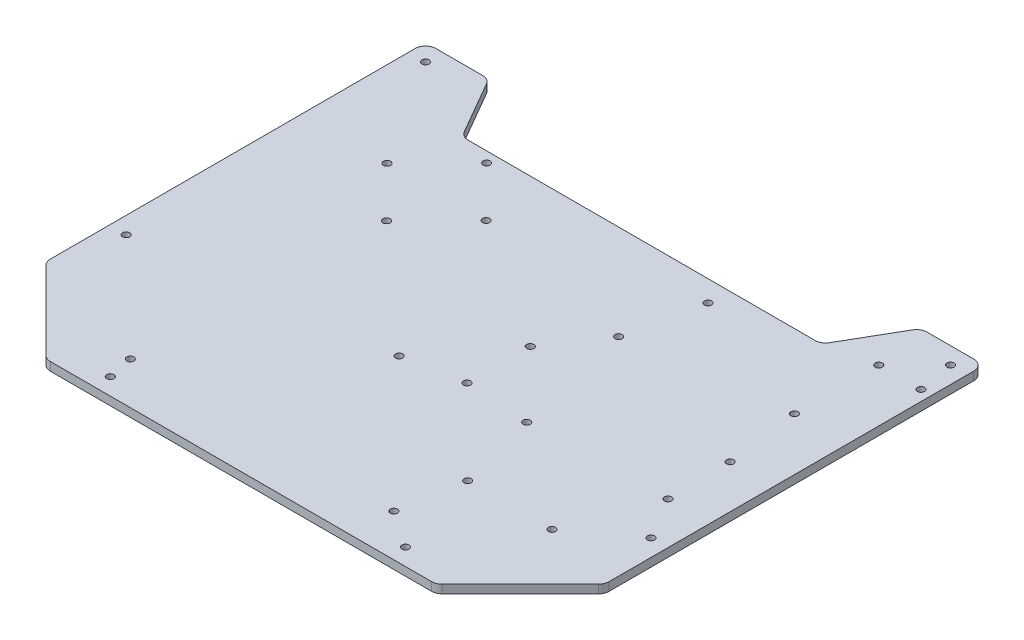
from build123d import *

# Parameters (mm, degrees)
MAIN_EXTRUSION_DEPTH    = 4
CONG_1_R                = 5
ESQUISSE1_R             = 1
ENL_V_MAT_EXTRU_1_DEPTH = 257.850637531
D_GAGEMENT_M31_D        = 3.4
ESQUISSE4_R             = 1
ENL_V_MAT_EXTRU_2_DEPTH = 257.850637531
D_GAGEMENT_M32_D        = 3.4


with BuildPart() as part:
    # Main scetch → Main extrusion (new body)
    with BuildSketch(Plane(origin=(0, 0, 0), x_dir=(1, 0, 0), z_dir=(0, 1, 0))):
        Polygon((-92.5, 0), (92.5, 0), (132.5, 40), (132.5, 220), (102.5, 220), (85.179491924, 190), (-85.179491924, 190), (-102.5, 220), (-132.5, 220), (-132.5, 40), align=None)
    extrude(amount=MAIN_EXTRUSION_DEPTH)

    # Congé1
    cong_1_edges = [part.edges().sort_by_distance(p)[0] for p in [
        (-132.5, 2, -40),
        (-92.5, 2, 0),
        (92.5, 2, 0),
        (132.5, 2, -40),
        (132.5, 2, -220),
        (102.5, 2, -220),
        (85.179491924, 2, -190),
        (-85.179491924, 2, -190),
        (-102.5, 2, -220),
        (-132.5, 2, -220),
    ]]
    fillet(cong_1_edges, radius=CONG_1_R)

    # Esquisse1 → Enlèv. mat.-Extru.1 (cut, through all)
    with BuildSketch(Plane(origin=(0, 4, 0), x_dir=(1, 0, 0), z_dir=(0, 1, 0))):
        with Locations((70, 8)):
            Circle(ESQUISSE1_R)
        with Locations((124.5, 70)):
            Circle(ESQUISSE1_R)
        with Locations((124.5, 212)):
            Circle(ESQUISSE1_R)
        with Locations((-124.5, 212)):
            Circle(ESQUISSE1_R)
        with Locations((-124.5, 70)):
            Circle(ESQUISSE1_R)
        with Locations((-70, 8)):
            Circle(ESQUISSE1_R)
    extrude(amount=-ENL_V_MAT_EXTRU_1_DEPTH, mode=Mode.SUBTRACT)

    # Dégagement M31 (through all)
    with Locations(Plane(origin=(0, 4, 0), x_dir=(1, 0, 0), z_dir=(0, 1, 0))):
        with Locations((-124.5, 212), (-124.5, 70), (-70, 8), (70, 8), (124.5, 70), (124.5, 212)):
            Hole(D_GAGEMENT_M31_D / 2)

    # Esquisse4 → Enlèv. mat.-Extru.2 (cut, through all)
    with BuildSketch(Plane(origin=(0, 4, 0), x_dir=(1, 0, 0), z_dir=(0, 1, 0))):
        with Locations((-68.5, 185)):
            Circle(ESQUISSE4_R)
        with Locations((41.5, 180)):
            Circle(ESQUISSE4_R)
        with Locations((34.12, 145)):
            Circle(ESQUISSE4_R)
        with Locations((107.5, 155)):
            Circle(ESQUISSE4_R)
        with Locations((127.5, 195)):
            Circle(ESQUISSE4_R)
        with Locations((112, 120)):
            Circle(ESQUISSE4_R)
        with Locations((112.5, 90)):
            Circle(ESQUISSE4_R)
        with Locations((17.2, 120)):
            Circle(ESQUISSE4_R)
        with Locations((17.2, 90)):
            Circle(ESQUISSE4_R)
        with Locations((47.5, 88)):
            Circle(ESQUISSE4_R)
        with Locations((57.5, 50)):
            Circle(ESQUISSE4_R)
        with Locations((97.5, 50)):
            Circle(ESQUISSE4_R)
        with Locations((52.5, 20)):
            Circle(ESQUISSE4_R)
        with Locations((-10, 85)):
            Circle(ESQUISSE4_R)
        with Locations((-72.5, 20)):
            Circle(ESQUISSE4_R)
        with Locations((107.5, 195)):
            Circle(ESQUISSE4_R)
        with Locations((-68.5, 137.5)):
            Circle(ESQUISSE4_R)
        with Locations((-92, 161.25)):
            Circle(ESQUISSE4_R)
        with Locations((-45, 161.25)):
            Circle(ESQUISSE4_R)
    extrude(amount=-ENL_V_MAT_EXTRU_2_DEPTH, mode=Mode.SUBTRACT)

    # Dégagement M32 (through all)
    with Locations(Plane(origin=(0, 4, 0), x_dir=(1, 0, 0), z_dir=(0, 1, 0))):
        with Locations((-68.5, 185), (17.2, 120), (34.12, 145), (41.5, 180), (107.5, 155), (127.5, 195), (112, 120), (112.5, 90), (47.5, 88), (17.2, 90), (57.5, 50), (97.5, 50), (-10, 85), (-72.5, 20), (52.5, 20), (107.5, 195), (-68.5, 137.5), (-92, 161.25), (-45, 161.25)):
            Hole(D_GAGEMENT_M32_D / 2)


solid = part.part
